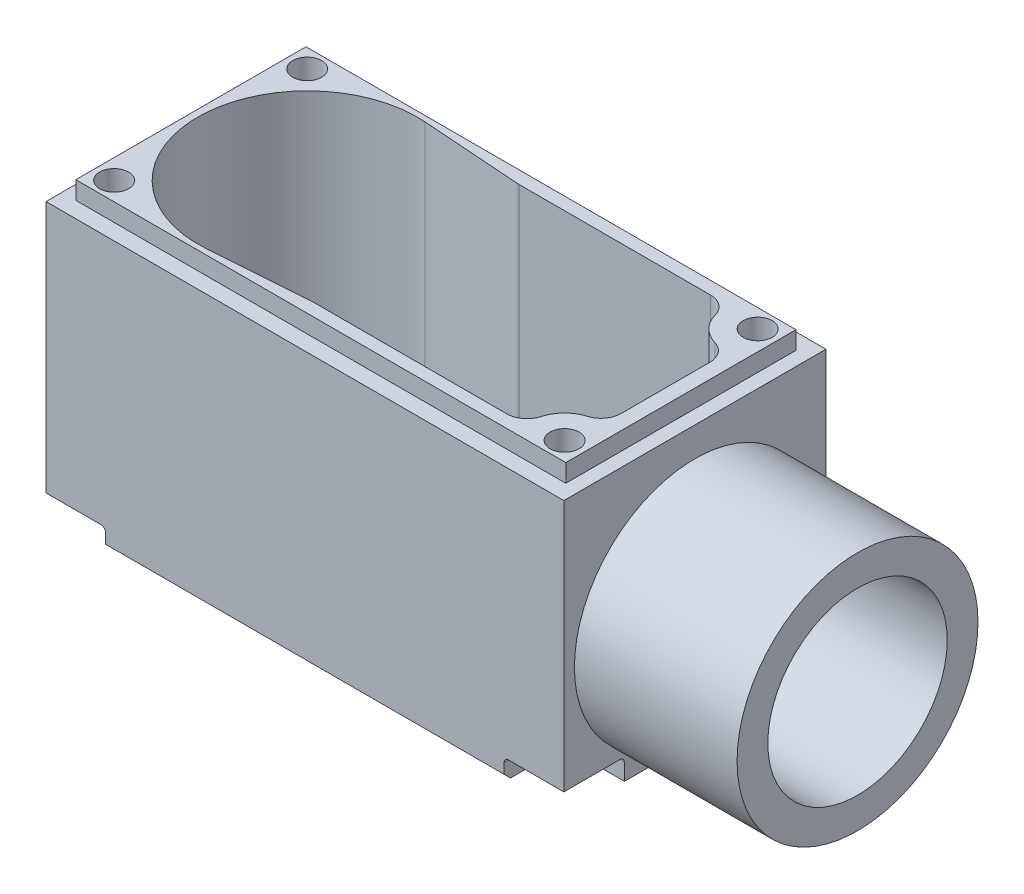
from build123d import *
from build123d.topology import SkipClean

# Parameters (mm, degrees)
SKETCH1_W                          = 40.386
SKETCH1_H                          = 20.447
BOSS_EXTRUDE1_DEPTH                = 21.336
CHAMFER1_SIZE                      = 0.508
F_2_CLEARANCE_HOLE1_D              = 2.2606
SKETCH6_R                          = 8.5725
CUT_EXTRUDE1_DEPTH                 = 19.558
CUT_EXTRUDE4_DEPTH                 = 19.558
FILLET3_R                          = 1.5875
CUT_EXTRUDE5_START                 = -1.651
CUT_EXTRUDE5_OUTLINE_R             = 1.1303
CUT_EXTRUDE5_DEPTH                 = 1.651
FILLET5_R                          = 0.381
BOSS_EXTRUDE3_START                = 1.397
SKETCH12_W                         = 38.227
SKETCH12_H                         = 17.9578
SKETCH12_R                         = 1.1303
BOSS_EXTRUDE3_DEPTH                = 1.397
BOSS_EXTRUDE4_DEPTH                = 12.7
TAPPED_HOLE_FOR_PG9_CONDUIT1_D     = 14
TAPPED_HOLE_FOR_PG9_CONDUIT1_DEPTH = 13.716
TAPPED_HOLE_FOR_PG9_CONDUIT1_TIP   = 4.206024333
BOSS_EXTRUDE5_START                = -1.218921199
SKETCH24_R                         = 7
BOSS_EXTRUDE5_DEPTH                = 1.218921199
CUT_EXTRUDE8_REACH                 = 48.597
CUT_EXTRUDE11_START                = -12.6873
SKETCH26_R                         = 9.398
CUT_EXTRUDE11_DEPTH                = 12.6873


# Read off the part's stored shape, not the designer's step: Cut-Extrude5
with BuildPart() as part:
    # Sketch1 → Boss-Extrude1 (new body)
    with BuildSketch(Plane(origin=(0, 0, 0), x_dir=(1, 0, 0), z_dir=(0, 1, 0))):
        Rectangle(SKETCH1_W, SKETCH1_H)
    extrude(amount=BOSS_EXTRUDE1_DEPTH)

    # Chamfer1
    chamfer1_edges = [part.edges().sort_by_distance(p)[0] for p in [
        (0, 0, 10.2235),
    ]]
    chamfer(chamfer1_edges, length=CHAMFER1_SIZE)

    # #2 Clearance Hole1 (through all)
    with Locations(Plane(origin=(0, 21.336, 0), x_dir=(1, 0, 0), z_dir=(0, 1, 0))):
        with Locations((17.57045, -7.5311), (-17.57045, 7.5311), (-17.57045, -7.5311), (17.57045, 7.5311)):
            Hole(F_2_CLEARANCE_HOLE1_D / 2)

    # Sketch6 → Cut-Extrude1 (cut)
    with BuildSketch(Plane(origin=(0, 21.336, 0), x_dir=(1, 0, 0), z_dir=(0, 1, 0))):
        with Locations(Location((-10.014739789, 0, 0), (0, 0, 270))):
            Circle(SKETCH6_R)
    extrude(amount=-CUT_EXTRUDE1_DEPTH, mode=Mode.SUBTRACT)

    # Sketch10 → Cut-Extrude4 (cut)
    with BuildSketch(Plane(origin=(0, 21.336, 0), x_dir=(1, 0, 0), z_dir=(0, 1, 0))):
        with BuildLine():
            Line((-1.45309254, -7.9883), (14.988060281, -7.9883))
            ThreePointArc((14.988060281, -7.9883), (15.691271985, -5.7017672), (17.958078801, -4.937355137))
            Line((17.958078801, -4.937355137), (17.958078801, 4.866749859))
            ThreePointArc((17.958078801, 4.866749859), (15.641892996, 5.652354237), (14.917152821, 7.9883))
            Line((14.917152821, 7.9883), (-1.524, 7.9883))
            Line((-1.524, 7.9883), (-9.404450133, 8.550748668))
            ThreePointArc((-9.404450133, 8.550748668), (-1.442240219, -0.00271347), (-9.409863426, -8.551133307))
            Line((-9.409863426, -8.551133307), (-1.45309254, -7.9883))
        make_face()
    extrude(amount=-CUT_EXTRUDE4_DEPTH, mode=Mode.SUBTRACT)

    # Fillet3
    # the kernel refuses this fillet: 1.5875 mm, written as the material it adds along each edge
    with BuildSketch(Plane(origin=(17.958078801, 21.336, 4.937355137), x_dir=(0, 0, -1), z_dir=(0, -1, 0))) as fillet3_piece_1:
        with BuildLine():
            CenterArc((1.441701842, -1.5875), FILLET3_R, 90, 73.441052757)
            ThreePointArc((-0.079959812, -1.13505988), (0.022321973, -0.571918824), (0, 0))
            Line((0, 0), (1.441701842, 0))
        make_face()
    extrude(amount=19.558)
    with BuildSketch(Plane(origin=(14.988060281, 21.336, 7.9883), x_dir=(0.048272098089337995, 0, -0.9988342227547339), z_dir=(0, -1, 0))) as fillet3_piece_2:
        with BuildLine():
            CenterArc((1.514540022, -1.548008005), FILLET3_R, 102.806774289, 74.426362957)
            Line((-0.071109307, -1.47137605), (0, 0))
            ThreePointArc((0, 0), (0.581324376, -0.065240775), (1.162648753, 0))
        make_face()
    extrude(amount=19.558)
    with BuildSketch(Plane(origin=(14.917152821, 21.336, -7.9883), x_dir=(-1, 0, 0), z_dir=(0, -1, 0))) as fillet3_piece_3:
        with BuildLine():
            CenterArc((1.474652181, -1.5875), FILLET3_R, 90, 74.686818151)
            ThreePointArc((-0.056486306, -1.168249258), (0.035961125, -0.587228986), (0, 0))
            Line((0, 0), (1.474652181, 0))
        make_face()
    extrude(amount=19.558)
    with BuildSketch(Plane(origin=(17.958078801, 21.336, -4.866749859), x_dir=(-0.9975619874511197, 0, -0.06978596701753238), z_dir=(0, -1, 0))) as fillet3_piece_4:
        with BuildLine():
            CenterArc((1.48286456, -1.551181233), FILLET3_R, 102.279418141, 73.718887891)
            Line((-0.100765095, -1.44039601), (0, 0))
            ThreePointArc((0, 0), (0.572618009, -0.061596629), (1.145236017, 0))
        make_face()
    extrude(amount=19.558)
    # the kernel refuses this fillet: 1.5875 mm, written as the material it takes off along each edge
    with BuildSketch(Plane(origin=(-1.45309254, 21.476192389, 7.9883), x_dir=(-0.9975075307142005, 0, 0.07056008906214724), z_dir=(0, -1, 0))) as fillet3_2_piece_1:
        with BuildLine():
            CenterArc((FILLET3_R * 0.0353240666066, -FILLET3_R), FILLET3_R, 90, 4.046157505)
            Line((-FILLET3_R * 0.0352360224555, -FILLET3_R * 0.0024924692858), (0, 0))
            Line((0, 0), (FILLET3_R * 0.0353240666066, 0))
        make_face()
    extrude(amount=19.698192389, mode=Mode.SUBTRACT)
    with BuildSketch(Plane(origin=(-1.524, 21.477450207, -7.9883), x_dir=(-0.9974626617850719, 0, -0.0711915609088555), z_dir=(0, -1, 0))) as fillet3_2_piece_2:
        with BuildLine():
            CenterArc((FILLET3_R * 0.0356409970864, FILLET3_R), FILLET3_R, 265.917570604, 4.082429396)
            Line((-FILLET3_R * 0.0355505638225, FILLET3_R * 0.00253733821493), (0, 0))
            Line((0, 0), (FILLET3_R * 0.0356409970864, 0))
        make_face()
    extrude(amount=19.699450207, mode=Mode.SUBTRACT)

    # Cut-Extrude5 outline → Cut-Extrude5 (cut)
    # profile 1 of 4: a face of its own
    with BuildSketch(Plane.XZ.offset(CUT_EXTRUDE5_START)):
        with BuildLine():
            Line((15.53845, 10.2235), (15.53845, 7.5311))
            ThreePointArc((15.53845, 7.5311), (16.133609021, 6.094259021), (17.57045, 5.4991))
            Line((17.57045, 5.4991), (20.193, 5.4991))
            Line((20.193, 5.4991), (20.193, 10.2235))
            Line((20.193, 10.2235), (15.53845, 10.2235))
        make_face()
        with Locations((17.57045, 7.5311)):
            Circle(CUT_EXTRUDE5_OUTLINE_R, mode=Mode.SUBTRACT)
    # profile 2 of 4: a face of its own
    with BuildSketch(Plane.XZ.offset(CUT_EXTRUDE5_START)):
        with BuildLine():
            Line((-15.53845, 7.5311), (-15.53845, 10.2235))
            Line((-15.53845, 10.2235), (-20.193, 10.2235))
            Line((-20.193, 10.2235), (-20.193, 5.4991))
            Line((-20.193, 5.4991), (-17.57045, 5.4991))
            ThreePointArc((-17.57045, 5.4991), (-16.133609021, 6.094259021), (-15.53845, 7.5311))
        make_face()
        with Locations((-17.57045, 7.5311)):
            Circle(CUT_EXTRUDE5_OUTLINE_R, mode=Mode.SUBTRACT)
    # profile 3 of 4: a face of its own
    with BuildSketch(Plane.XZ.offset(CUT_EXTRUDE5_START)):
        with BuildLine():
            Line((20.193, -10.2235), (20.193, -5.4991))
            Line((20.193, -5.4991), (17.57045, -5.4991))
            ThreePointArc((17.57045, -5.4991), (16.133609021, -6.094259021), (15.53845, -7.5311))
            Line((15.53845, -7.5311), (15.53845, -10.2235))
            Line((15.53845, -10.2235), (20.193, -10.2235))
        make_face()
        with Locations((17.57045, -7.5311)):
            Circle(CUT_EXTRUDE5_OUTLINE_R, mode=Mode.SUBTRACT)
    # profile 4 of 4: a face of its own
    with BuildSketch(Plane.XZ.offset(CUT_EXTRUDE5_START)):
        with BuildLine():
            Line((-17.57045, -5.4991), (-20.193, -5.4991))
            Line((-20.193, -5.4991), (-20.193, -10.2235))
            Line((-20.193, -10.2235), (-15.53845, -10.2235))
            Line((-15.53845, -10.2235), (-15.53845, -7.5311))
            ThreePointArc((-15.53845, -7.5311), (-16.133609021, -6.094259021), (-17.57045, -5.4991))
        make_face()
        with Locations((-17.57045, -7.5311)):
            Circle(CUT_EXTRUDE5_OUTLINE_R, mode=Mode.SUBTRACT)
    extrude(amount=CUT_EXTRUDE5_DEPTH, mode=Mode.SUBTRACT)

    # Fillet5
    fillet5_edges = [part.edges().sort_by_distance(p)[0] for p in [
        (-18.881725, 1.651, -5.4991),
        (-16.133609021, 1.651, -6.094259021),
        (-15.53845, 1.651, -8.8773),
        (18.881725, 1.651, 5.4991),
        (16.133609021, 1.651, 6.094259021),
        (15.53845, 1.651, 8.8773),
        (15.53845, 1.651, -8.8773),
        (16.133609021, 1.651, -6.094259021),
        (18.881725, 1.651, -5.4991),
        (-15.53845, 1.651, 8.8773),
        (-16.133609021, 1.651, 6.094259021),
        (-18.881725, 1.651, 5.4991),
    ]]
    fillet(fillet5_edges, radius=FILLET5_R)

    # Sketch12 → Boss-Extrude3 (add)
    with BuildSketch(Plane(origin=(0, 21.336, 0), x_dir=(1, 0, 0), z_dir=(0, 1, 0)).offset(BOSS_EXTRUDE3_START)):
        Rectangle(SKETCH12_W, SKETCH12_H)
        with Locations(Location((17.57045, -7.5311, 0), (0, 0, 270))):
            Circle(SKETCH12_R, mode=Mode.SUBTRACT)
        with Locations(Location((17.57045, 7.5311, 0), (0, 0, 270))):
            Circle(SKETCH12_R, mode=Mode.SUBTRACT)
        with Locations(Location((-17.57045, -7.5311, 0), (0, 0, 270))):
            Circle(SKETCH12_R, mode=Mode.SUBTRACT)
        with Locations(Location((-17.57045, 7.5311, 0), (0, 0, 270))):
            Circle(SKETCH12_R, mode=Mode.SUBTRACT)
        with BuildLine():
            Line((17.958078801, -3.495653295), (17.958078801, 3.422833563))
            ThreePointArc((17.958078801, 3.422833563), (17.640752565, 4.375101834), (16.815634884, 4.946671262))
            ThreePointArc((16.815634884, 4.946671262), (15.6506227, 5.643434538), (14.973639127, 6.820050742))
            ThreePointArc((14.973639127, 6.820050742), (14.405463697, 7.662884942), (13.44250064, 7.9883))
            Line((13.44250064, 7.9883), (-1.467419917, 7.9883))
            ThreePointArc((-1.467419917, 7.9883), (-1.523964098, 7.989307326), (-1.58043652, 7.992328024))
            Line((-1.58043652, 7.992328024), (-9.404450133, 8.550748668))
            ThreePointArc((-9.404450133, 8.550748668), (-18.58723936, 0.00271347), (-9.409863426, -8.551133307))
            Line((-9.409863426, -8.551133307), (-1.509029726, -7.992256795))
            ThreePointArc((-1.509029726, -7.992256795), (-1.453057587, -7.989289507), (-1.397015585, -7.9883))
            Line((-1.397015585, -7.9883), (13.514966932, -7.9883))
            ThreePointArc((13.514966932, -7.9883), (14.475058911, -7.665070399), (15.044183775, -6.827006637))
            ThreePointArc((15.044183775, -6.827006637), (15.70015069, -5.692690635), (16.823018922, -5.017314948))
            ThreePointArc((16.823018922, -5.017314948), (17.64305767, -4.444839146), (17.958078801, -3.495653295))
        make_face(mode=Mode.SUBTRACT)
    extrude(amount=-BOSS_EXTRUDE3_DEPTH)

    # Sketch14 → Boss-Extrude4 (add)
    with BuildSketch(Plane(origin=(20.193, 0, 0), x_dir=(0, 0, -1), z_dir=(1, 0, 0))):
        with BuildLine():
            Line((-10.2235, 1.651), (-5.8801, 1.651))
            ThreePointArc((-5.8801, 1.651), (-5.610692316, 1.539407684), (-5.4991, 1.27))
            Line((-5.4991, 1.27), (-5.4991, 0))
            Line((-5.4991, 0), (5.4991, 0))
            Line((5.4991, 0), (5.4991, 1.27))
            ThreePointArc((5.4991, 1.27), (5.610692316, 1.539407684), (5.8801, 1.651))
            Line((5.8801, 1.651), (10.2235, 1.651))
            Line((10.2235, 1.651), (10.2235, 21.336))
            Line((10.2235, 21.336), (-10.2235, 21.336))
            Line((-10.2235, 21.336), (-10.2235, 1.651))
        make_face()
    extrude(amount=BOSS_EXTRUDE4_DEPTH)

    # Tapped Hole for Pg9 Conduit1
    with Locations(Plane(origin=(32.893, 0, 0), x_dir=(0, 0, -1), z_dir=(1, 0, 0))):
        with Locations((0, 9.652)):
            Hole(TAPPED_HOLE_FOR_PG9_CONDUIT1_D / 2, depth=TAPPED_HOLE_FOR_PG9_CONDUIT1_DEPTH)
            with Locations((0, 0, -(TAPPED_HOLE_FOR_PG9_CONDUIT1_DEPTH + TAPPED_HOLE_FOR_PG9_CONDUIT1_TIP / 2))):  # 118° drill point
                Cone(0, TAPPED_HOLE_FOR_PG9_CONDUIT1_D / 2, TAPPED_HOLE_FOR_PG9_CONDUIT1_TIP, mode=Mode.SUBTRACT)

    # Sketch24 → Boss-Extrude5 (add)
    with SkipClean():  # the faces are left unmerged after this step: merging them gives an invalid solid
        with BuildSketch(Plane(origin=(19.177, 0, 0), x_dir=(0, 0, -1), z_dir=(1, 0, 0)).offset(BOSS_EXTRUDE5_START)):
            with Locations((0, 9.652)):
                Circle(SKETCH24_R)
        extrude(amount=BOSS_EXTRUDE5_DEPTH)

    # Sketch25 → Cut-Extrude8 (cut, up to next)
    with BuildSketch(Plane(origin=(19.177, 0, 0), x_dir=(0, 0, -1), z_dir=(1, 0, 0)), mode=Mode.PRIVATE) as cut_extrude8_sk1:
        with BuildLine():
            Line((4.946671262, 4.699178236), (4.946671262, 14.604821764))
            ThreePointArc((4.946671262, 14.604821764), (-0.050283679, 16.651819394), (-5.017314948, 14.533244791))
            Line((-5.017314948, 14.533244791), (-5.017314948, 4.770755209))
            ThreePointArc((-5.017314948, 4.770755209), (-0.050283679, 2.652180606), (4.946671262, 4.699178236))
        make_face()
    cut_extrude8_tool1 = extrude(cut_extrude8_sk1.sketch, amount=-CUT_EXTRUDE8_REACH, mode=Mode.PRIVATE) & part.part
    add(cut_extrude8_tool1.solids().sort_by_distance((19.177, 9.652, 0.027338))[0], mode=Mode.SUBTRACT)

    # Sketch26 → Cut-Extrude11 (cut)
    with SkipClean():  # the faces are left unmerged after this step: merging them gives an invalid solid
        with BuildSketch(Plane(origin=(32.893, 0, 0), x_dir=(0, 0, -1), z_dir=(1, 0, 0)).offset(CUT_EXTRUDE11_START)):
            with BuildLine():
                Line((-5.4991, 0), (5.4991, 0))
                Line((5.4991, 0), (5.4991, 1.27))
                ThreePointArc((5.4991, 1.27), (5.610692316, 1.539407684), (5.8801, 1.651))
                Line((5.8801, 1.651), (10.2235, 1.651))
                Line((10.2235, 1.651), (10.2235, 21.336))
                Line((10.2235, 21.336), (-10.2235, 21.336))
                Line((-10.2235, 21.336), (-10.2235, 1.651))
                Line((-10.2235, 1.651), (-5.8801, 1.651))
                ThreePointArc((-5.8801, 1.651), (-5.610692316, 1.539407684), (-5.4991, 1.27))
                Line((-5.4991, 1.27), (-5.4991, 0))
            make_face()
            with Locations((0, 9.652)):
                Circle(SKETCH26_R, mode=Mode.SUBTRACT)
        extrude(amount=CUT_EXTRUDE11_DEPTH, mode=Mode.SUBTRACT)


solid = part.part
